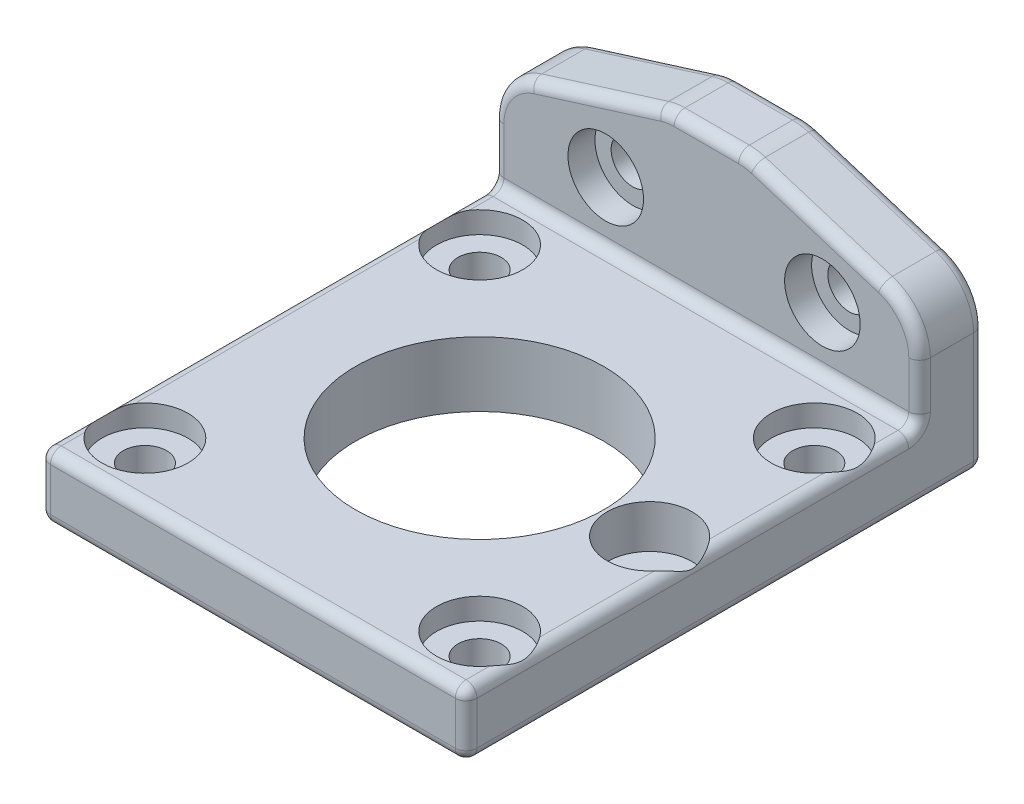
from build123d import *

# Parameters (mm, degrees)
SKETCH1_W           = 39.5
SKETCH1_H           = 42
BOSS_EXTRUDE1_DEPTH = 6
SKETCH3_R           = 3.9905
CUT_EXTRUDE1_DEPTH  = 2
SKETCH4_R           = 11.5
SKETCH4_R_2         = 2
CUT_EXTRUDE2_DEPTH  = 30.445925015
BOSS_EXTRUDE2_DEPTH = 6
SKETCH6_R           = 3.5
CUT_EXTRUDE3_DEPTH  = 2.5
SKETCH7_R           = 2
CUT_EXTRUDE4_DEPTH  = 51.537733428
FILLET1_R           = 5
SKETCH8_R           = 3.9365
CUT_EXTRUDE5_DEPTH  = 4
FILLET2_R           = 1


with BuildPart() as part:
    # Sketch1 → Boss-Extrude1 (new body)
    with BuildSketch(Plane(origin=(0, 0, 0), x_dir=(1, 0, 0), z_dir=(0, 1, 0))):
        Rectangle(SKETCH1_W, SKETCH1_H)
    extrude(amount=BOSS_EXTRUDE1_DEPTH)

    # Sketch3 → Cut-Extrude1 (cut)
    with BuildSketch(Plane(origin=(0, 6, 0), x_dir=(1, 0, 0), z_dir=(0, 1, 0))):
        with Locations(Location((-15.5, 15.5, 0), (0, 0, 270))):
            Circle(SKETCH3_R)
        with Locations(Location((15.5, 15.5, 0), (0, 0, 270))):
            Circle(SKETCH3_R)
        with Locations(Location((-15.5, -15.5, 0), (0, 0, 270))):
            Circle(SKETCH3_R)
        with Locations(Location((15.5, -15.5, 0), (0, 0, 270))):
            Circle(SKETCH3_R)
    extrude(amount=-CUT_EXTRUDE1_DEPTH, mode=Mode.SUBTRACT)

    # Sketch4 → Cut-Extrude2 (cut, through all)
    with BuildSketch(Plane(origin=(0, 6, 0), x_dir=(1, 0, 0), z_dir=(0, 1, 0))):
        with Locations(Location((0, 0, 0), (0, 0, 270))):
            Circle(SKETCH4_R)
        with Locations(Location((15.5, 15.5, 0), (0, 0, 270))):
            Circle(SKETCH4_R_2)
        with Locations(Location((-15.5, 15.5, 0), (0, 0, 270))):
            Circle(SKETCH4_R_2)
        with Locations(Location((-15.5, -15.5, 0), (0, 0, 270))):
            Circle(SKETCH4_R_2)
        with Locations(Location((15.5, -15.5, 0), (0, 0, 270))):
            Circle(SKETCH4_R_2)
    extrude(amount=-CUT_EXTRUDE2_DEPTH, mode=Mode.SUBTRACT)

    # Sketch5 → Boss-Extrude2 (add)
    with BuildSketch(Plane(origin=(0, 0, -21), x_dir=(-1, 0, 0), z_dir=(0, 0, -1))):
        Polygon((-19.75, 15), (-19.75, 0), (19.75, 0), (19.75, 15), (3.75, 20), (-3.75, 20), align=None)
    extrude(amount=BOSS_EXTRUDE2_DEPTH)

    # Sketch6 → Cut-Extrude3 (cut)
    with BuildSketch(Plane.XY.offset(-21)):
        with Locations((-9.32, 11.75)):
            Circle(SKETCH6_R)
        with Locations((10.75, 11.75)):
            Circle(SKETCH6_R)
    extrude(amount=-CUT_EXTRUDE3_DEPTH, mode=Mode.SUBTRACT)

    # Sketch7 → Cut-Extrude4 (cut, through all)
    with BuildSketch(Plane.XY.offset(-21)):
        with Locations((-9.32, 11.75)):
            Circle(SKETCH7_R)
        with Locations((10.75, 11.75)):
            Circle(SKETCH7_R)
    extrude(amount=-CUT_EXTRUDE4_DEPTH, mode=Mode.SUBTRACT)

    # Fillet1
    fillet1_edges = [part.edges().sort_by_distance(p)[0] for p in [
        (-19.75, 15, -24),
        (-3.75, 20, -24),
        (3.75, 20, -24),
        (19.75, 15, -24),
    ]]
    fillet(fillet1_edges, radius=FILLET1_R)

    # Sketch8 → Cut-Extrude5 (cut)
    with BuildSketch(Plane(origin=(0, 6, 0), x_dir=(1, 0, 0), z_dir=(0, 1, 0))):
        with Locations(Location((15.75, 0, 0), (0, 0, 270))):
            Circle(SKETCH8_R)
    extrude(amount=-CUT_EXTRUDE5_DEPTH, mode=Mode.SUBTRACT)

    # Fillet2
    # the kernel refuses this fillet: 1 mm, written as the material it adds along each edge
    with BuildSketch(Plane(origin=(-19.75, 6, -21), x_dir=(0, 1, 0), z_dir=(1, 0, 0))) as fillet2_piece_1:
        with BuildLine():
            CenterArc((FILLET2_R, FILLET2_R), FILLET2_R, 180, 90)
            Line((0, FILLET2_R), (0, 0))
            Line((0, 0), (FILLET2_R, 0))
        make_face()
    extrude(amount=39.5)
    # the kernel refuses this fillet: 1 mm, written as the material it takes off along each edge
    with BuildSketch(Plane(origin=(18.75, 1, 20), x_dir=(0, 0, 1), z_dir=(1, 0, 0))) as fillet2_2_piece_1_section:
        Polygon((0, 0), (FILLET2_R, 0), (FILLET2_R, FILLET2_R), (0, FILLET2_R), align=None)
    fillet2_2_piece_1 = extrude(amount=FILLET2_R, mode=Mode.PRIVATE)
    fillet2_2_piece_1 = fillet2_2_piece_1 - Plane(origin=(18.75, 1, 20), x_dir=(0, 0.7071067811865475, -0.7071067811865475), z_dir=(1, 0, 0)) * Sphere(FILLET2_R, mode=Mode.PRIVATE)
    add(fillet2_2_piece_1, mode=Mode.SUBTRACT)
    with BuildSketch(Plane(origin=(-18.75, 1, 20), x_dir=(0, 0, 1), z_dir=(-1, 0, 0))) as fillet2_2_piece_2_section:
        Polygon((0, 0), (FILLET2_R, 0), (FILLET2_R, -FILLET2_R), (0, -FILLET2_R), align=None)
    fillet2_2_piece_2 = extrude(amount=FILLET2_R, mode=Mode.PRIVATE)
    fillet2_2_piece_2 = fillet2_2_piece_2 - Plane(origin=(-18.75, 1, 20), x_dir=(0, 0.7071067811865475, -0.7071067811865475), z_dir=(-1, 0, 0)) * Sphere(FILLET2_R, mode=Mode.PRIVATE)
    add(fillet2_2_piece_2, mode=Mode.SUBTRACT)
    with BuildSketch(Plane(origin=(-18.75, 1, -26), x_dir=(0, 0, -1), z_dir=(-1, 0, 0))) as fillet2_2_piece_3_section:
        Polygon((0, 0), (FILLET2_R, 0), (FILLET2_R, FILLET2_R), (0, FILLET2_R), align=None)
    fillet2_2_piece_3 = extrude(amount=FILLET2_R, mode=Mode.PRIVATE)
    fillet2_2_piece_3 = fillet2_2_piece_3 - Plane(origin=(-18.75, 1, -26), x_dir=(0, 0.7071067811865475, 0.7071067811865475), z_dir=(-1, 0, 0)) * Sphere(FILLET2_R, mode=Mode.PRIVATE)
    add(fillet2_2_piece_3, mode=Mode.SUBTRACT)
    with BuildSketch(Plane(origin=(18.75, 1, -26), x_dir=(0, 0, -1), z_dir=(1, 0, 0))) as fillet2_2_piece_4_section:
        Polygon((0, 0), (FILLET2_R, 0), (FILLET2_R, -FILLET2_R), (0, -FILLET2_R), align=None)
    fillet2_2_piece_4 = extrude(amount=FILLET2_R, mode=Mode.PRIVATE)
    fillet2_2_piece_4 = fillet2_2_piece_4 - Plane(origin=(18.75, 1, -26), x_dir=(0, 0.7071067811865475, 0.7071067811865475), z_dir=(1, 0, 0)) * Sphere(FILLET2_R, mode=Mode.PRIVATE)
    add(fillet2_2_piece_4, mode=Mode.SUBTRACT)
    with BuildSketch(Plane(origin=(-2.986945386, 15, -27), x_dir=(-0.2982749931359463, 0.9544799780350299, 0), z_dir=(-0.9544799780350299, -0.2982749931359463, 0))) as fillet2_2_piece_5:
        with BuildLine():
            CenterArc((5 - FILLET2_R, -FILLET2_R), FILLET2_R, 0, 90)
            Line((5, -FILLET2_R), (5, 0))
            Line((5, 0), (5 - FILLET2_R, 0))
        make_face()
    revolve(axis=Axis((-2.986945386, 15, -27), (0, 0, -1)), revolution_arc=17.354024636, mode=Mode.SUBTRACT)
    with BuildSketch(Plane(origin=(2.986945386, 15, -27), x_dir=(0.29827499313594724, 0.9544799780350296, 0), z_dir=(0.9544799780350296, -0.29827499313594724, 0))) as fillet2_2_piece_6:
        with BuildLine():
            CenterArc((5 - FILLET2_R, FILLET2_R), FILLET2_R, 270, 90)
            Line((5, FILLET2_R), (5, 0))
            Line((5, 0), (5 - FILLET2_R, 0))
        make_face()
    revolve(axis=Axis((2.986945386, 15, -27), (0, 0, 1)), revolution_arc=17.354024636, mode=Mode.SUBTRACT)
    with BuildSketch(Plane(origin=(14.75, 11.324045433, -27), x_dir=(1, 0, 0), z_dir=(0, -1, 0))) as fillet2_2_piece_7:
        with BuildLine():
            CenterArc((5 - FILLET2_R, FILLET2_R), FILLET2_R, 270, 90)
            Line((5, FILLET2_R), (5, 0))
            Line((5, 0), (5 - FILLET2_R, 0))
        make_face()
    revolve(axis=Axis((14.75, 11.324045433, -27), (0, 0, 1)), revolution_arc=72.645975364, mode=Mode.SUBTRACT)
    with BuildSketch(Plane(origin=(22.25, 6, 21), x_dir=(0, 0, -1), z_dir=(-1, 0, 0))) as fillet2_2_piece_8:
        with BuildLine():
            CenterArc((FILLET2_R, FILLET2_R), FILLET2_R, 180, 90)
            Line((0, FILLET2_R), (0, 0))
            Line((0, 0), (FILLET2_R, 0))
        make_face()
    extrude(amount=44.5, mode=Mode.SUBTRACT)
    with BuildSketch(Plane(origin=(18.75, 0, 21), x_dir=(0, 1, 0), z_dir=(-1, 0, 0))) as fillet2_2_piece_9:
        with BuildLine():
            CenterArc((FILLET2_R, FILLET2_R), FILLET2_R, 180, 90)
            Line((0, FILLET2_R), (0, 0))
            Line((0, 0), (FILLET2_R, 0))
        make_face()
    extrude(amount=37.5, mode=Mode.SUBTRACT)
    with BuildSketch(Plane(origin=(-19.75, 0, -26), x_dir=(0, 1, 0), z_dir=(0, 0, 1)), Plane(origin=(19.75, 0, -26), x_dir=(-1, 0, 0), z_dir=(0, 0, 1))) as fillet2_2_piece_10:
        with BuildLine():
            CenterArc((FILLET2_R, -FILLET2_R), FILLET2_R, 90, 90)
            Line((0, -FILLET2_R), (0, 0))
            Line((0, 0), (FILLET2_R, 0))
        make_face()
    extrude(amount=46, mode=Mode.SUBTRACT)
    with BuildSketch(Plane(origin=(-19.75, 1, -27), x_dir=(0, 0, 1), z_dir=(0, 1, 0))) as fillet2_2_piece_11:
        with BuildLine():
            CenterArc((FILLET2_R, FILLET2_R), FILLET2_R, 180, 90)
            Line((0, FILLET2_R), (0, 0))
            Line((0, 0), (FILLET2_R, 0))
        make_face()
    extrude(amount=10.324045433, mode=Mode.SUBTRACT)
    with BuildSketch(Plane(origin=(18.75, 0, -27), x_dir=(0, 1, 0), z_dir=(-1, 0, 0))) as fillet2_2_piece_12:
        with BuildLine():
            CenterArc((FILLET2_R, -FILLET2_R), FILLET2_R, 90, 90)
            Line((0, -FILLET2_R), (0, 0))
            Line((0, 0), (FILLET2_R, 0))
        make_face()
    extrude(amount=37.5, mode=Mode.SUBTRACT)
    with BuildSketch(Plane(origin=(19.75, 1, 21), x_dir=(-1, 0, 0), z_dir=(0, 1, 0)), Plane(origin=(-19.75, 1, 21), x_dir=(0, 0, -1), z_dir=(0, 1, 0))) as fillet2_2_piece_13:
        with BuildLine():
            CenterArc((FILLET2_R, -FILLET2_R), FILLET2_R, 90, 90)
            Line((0, -FILLET2_R), (0, 0))
            Line((0, 0), (FILLET2_R, 0))
        make_face()
    extrude(amount=7.5, mode=Mode.SUBTRACT)
    with BuildSketch(Plane(origin=(19.75, 11.324045433, -27), x_dir=(-1, 0, 0), z_dir=(0, -1, 0))) as fillet2_2_piece_14:
        with BuildLine():
            CenterArc((FILLET2_R, -FILLET2_R), FILLET2_R, 90, 90)
            Line((0, -FILLET2_R), (0, 0))
            Line((0, 0), (FILLET2_R, 0))
        make_face()
    extrude(amount=10.324045433, mode=Mode.SUBTRACT)
    with BuildSketch(Plane(origin=(4.478320351, 19.77239989, -27), x_dir=(-0.29827499313594713, -0.9544799780350296, 0), z_dir=(0.9544799780350297, -0.29827499313594713, 0)), Plane(origin=(-16.241374966, 16.096445323, -27), x_dir=(0.2982749931359466, -0.9544799780350298, 0), z_dir=(0.9544799780350299, 0.29827499313594663, 0))) as fillet2_2_piece_15:
        with BuildLine():
            CenterArc((FILLET2_R, -FILLET2_R), FILLET2_R, 90, 90)
            Line((0, -FILLET2_R), (0, 0))
            Line((0, 0), (FILLET2_R, 0))
        make_face()
    extrude(amount=12.324045433, mode=Mode.SUBTRACT)
    with BuildSketch(Plane(origin=(-2.986945386, 20, -27), x_dir=(0, -1, 0), z_dir=(1, 0, 0))) as fillet2_2_piece_16:
        with BuildLine():
            CenterArc((FILLET2_R, -FILLET2_R), FILLET2_R, 90, 90)
            Line((0, -FILLET2_R), (0, 0))
            Line((0, 0), (FILLET2_R, 0))
        make_face()
    extrude(amount=5.973890772, mode=Mode.SUBTRACT)
    with BuildSketch(Plane(origin=(-14.75, 11.324045433, -27), x_dir=(-1, 0, 0), z_dir=(0, -1, 0))) as fillet2_2_piece_17:
        with BuildLine():
            CenterArc((5 - FILLET2_R, -FILLET2_R), FILLET2_R, 0, 90)
            Line((5 - FILLET2_R, 0), (5, 0))
            Line((5, 0), (5, -FILLET2_R))
        make_face()
    revolve(axis=Axis((-14.75, 11.324045433, -27), (0, 0, -1)), revolution_arc=72.645975364, mode=Mode.SUBTRACT)
    # the kernel refuses this fillet: 1 mm, written as the material it takes off along each edge
    with BuildSketch(Plane(origin=(18.75, 5, 20), x_dir=(1, 0, 0), z_dir=(0, 1, 0))) as fillet2_3_piece_1_section:
        Polygon((0, 0), (FILLET2_R, 0), (FILLET2_R, -FILLET2_R), (0, -FILLET2_R), align=None)
    fillet2_3_piece_1 = extrude(amount=FILLET2_R, mode=Mode.PRIVATE)
    fillet2_3_piece_1 = fillet2_3_piece_1 - Plane(origin=(18.75, 5, 20), x_dir=(-0.7071067811865476, 0, -0.7071067811865475), z_dir=(0, 1, 0)) * Sphere(FILLET2_R, mode=Mode.PRIVATE)
    add(fillet2_3_piece_1, mode=Mode.SUBTRACT)
    with BuildSketch(Plane(origin=(-18.75, 5, 20), x_dir=(0, 1, 0), z_dir=(-1, 0, 0))) as fillet2_3_piece_2_section:
        Polygon((0, 0), (FILLET2_R, 0), (FILLET2_R, -FILLET2_R), (0, -FILLET2_R), align=None)
    fillet2_3_piece_2 = extrude(amount=FILLET2_R, mode=Mode.PRIVATE)
    fillet2_3_piece_2 = fillet2_3_piece_2 - Plane(origin=(-18.75, 5, 20), x_dir=(0, -0.7071067811865475, -0.7071067811865475), z_dir=(-1, 0, 0)) * Sphere(FILLET2_R, mode=Mode.PRIVATE)
    add(fillet2_3_piece_2, mode=Mode.SUBTRACT)
    with BuildSketch(Plane(origin=(-19.75, 6, 20), x_dir=(0, -1, 0), z_dir=(0, 0, -1))) as fillet2_3_piece_3:
        with BuildLine():
            CenterArc((FILLET2_R, -FILLET2_R), FILLET2_R, 90, 90)
            Line((0, -FILLET2_R), (0, 0))
            Line((0, 0), (FILLET2_R, 0))
        make_face()
    extrude(amount=40, mode=Mode.SUBTRACT)
    with BuildSketch(Plane(origin=(19.75, 6, -20), x_dir=(-1, 0, 0), z_dir=(0, 0, 1))) as fillet2_3_piece_4:
        with BuildLine():
            CenterArc((FILLET2_R, FILLET2_R), FILLET2_R, 180, 90)
            Line((0, FILLET2_R), (0, 0))
            Line((0, 0), (FILLET2_R, 0))
        make_face()
    extrude(amount=40, mode=Mode.SUBTRACT)
    with BuildSketch(Plane(origin=(-19.75, 7, -21), x_dir=(0, 0, -1), z_dir=(0, 1, 0))) as fillet2_3_piece_5:
        with BuildLine():
            CenterArc((FILLET2_R, -FILLET2_R), FILLET2_R, 90, 90)
            Line((0, -FILLET2_R), (0, 0))
            Line((0, 0), (FILLET2_R, 0))
        make_face()
    extrude(amount=4.324045433, mode=Mode.SUBTRACT)
    with BuildSketch(Plane(origin=(19.75, 11.324045433, -21), x_dir=(-1, 0, 0), z_dir=(0, -1, 0))) as fillet2_3_piece_6:
        with BuildLine():
            CenterArc((FILLET2_R, FILLET2_R), FILLET2_R, 180, 90)
            Line((0, FILLET2_R), (0, 0))
            Line((0, 0), (FILLET2_R, 0))
        make_face()
    extrude(amount=4.324045433, mode=Mode.SUBTRACT)
    with BuildSketch(Plane(origin=(4.478320351, 19.77239989, -21), x_dir=(-0.29827499313594713, -0.9544799780350296, 0), z_dir=(0.9544799780350297, -0.29827499313594713, 0)), Plane(origin=(-16.241374966, 16.096445323, -21), x_dir=(0.2982749931359466, -0.9544799780350298, 0), z_dir=(0.9544799780350299, 0.29827499313594663, 0))) as fillet2_3_piece_7:
        with BuildLine():
            CenterArc((FILLET2_R, FILLET2_R), FILLET2_R, 180, 90)
            Line((0, FILLET2_R), (0, 0))
            Line((0, 0), (FILLET2_R, 0))
        make_face()
    extrude(amount=12.324045433, mode=Mode.SUBTRACT)
    with BuildSketch(Plane(origin=(-2.986945386, 20, -21), x_dir=(0, -1, 0), z_dir=(1, 0, 0))) as fillet2_3_piece_8:
        with BuildLine():
            CenterArc((FILLET2_R, FILLET2_R), FILLET2_R, 180, 90)
            Line((0, FILLET2_R), (0, 0))
            Line((0, 0), (FILLET2_R, 0))
        make_face()
    extrude(amount=5.973890772, mode=Mode.SUBTRACT)
    with BuildSketch(Plane(origin=(-14.75, 11.324045433, -21), x_dir=(-1, 0, 0), z_dir=(0, -1, 0))) as fillet2_3_piece_9:
        with BuildLine():
            CenterArc((5 - FILLET2_R, FILLET2_R), FILLET2_R, 270, 90)
            Line((5 - FILLET2_R, 0), (5, 0))
            Line((5, 0), (5, FILLET2_R))
        make_face()
    revolve(axis=Axis((-14.75, 11.324045433, -21), (0, 0, -1)), revolution_arc=72.645975364, mode=Mode.SUBTRACT)
    with BuildSketch(Plane(origin=(-2.986945386, 15, -21), x_dir=(-0.2982749931359463, 0.9544799780350299, 0), z_dir=(-0.9544799780350299, -0.2982749931359463, 0))) as fillet2_3_piece_10:
        with BuildLine():
            CenterArc((5 - FILLET2_R, FILLET2_R), FILLET2_R, 270, 90)
            Line((5, FILLET2_R), (5, 0))
            Line((5, 0), (5 - FILLET2_R, 0))
        make_face()
    revolve(axis=Axis((-2.986945386, 15, -21), (0, 0, -1)), revolution_arc=17.354024636, mode=Mode.SUBTRACT)
    with BuildSketch(Plane(origin=(2.986945386, 15, -21), x_dir=(0.29827499313594724, 0.9544799780350296, 0), z_dir=(0.9544799780350296, -0.29827499313594724, 0))) as fillet2_3_piece_11:
        with BuildLine():
            CenterArc((5 - FILLET2_R, -FILLET2_R), FILLET2_R, 0, 90)
            Line((5, -FILLET2_R), (5, 0))
            Line((5, 0), (5 - FILLET2_R, 0))
        make_face()
    revolve(axis=Axis((2.986945386, 15, -21), (0, 0, 1)), revolution_arc=17.354024636, mode=Mode.SUBTRACT)
    with BuildSketch(Plane(origin=(14.75, 11.324045433, -21), x_dir=(1, 0, 0), z_dir=(0, -1, 0))) as fillet2_3_piece_12:
        with BuildLine():
            CenterArc((5 - FILLET2_R, -FILLET2_R), FILLET2_R, 0, 90)
            Line((5, -FILLET2_R), (5, 0))
            Line((5, 0), (5 - FILLET2_R, 0))
        make_face()
    revolve(axis=Axis((14.75, 11.324045433, -21), (0, 0, 1)), revolution_arc=72.645975364, mode=Mode.SUBTRACT)
    with BuildSketch(Plane(origin=(19.75, 7, -20), x_dir=(0, 0, -1), z_dir=(0, 1, 0))) as fillet2_3_piece_13:
        with BuildLine():
            CenterArc((1 + FILLET2_R, FILLET2_R), FILLET2_R, 180, 90)
            Line((1 + FILLET2_R, 0), (1, 0))
            Line((1, 0), (1, FILLET2_R))
        make_face()
    revolve(axis=Axis((19.75, 7, -20), (-1, 0, 0)), revolution_arc=90, mode=Mode.SUBTRACT)
    with BuildSketch(Plane(origin=(-19.75, 7, -20), x_dir=(0, 0, -1), z_dir=(0, 1, 0))) as fillet2_3_piece_14:
        with BuildLine():
            CenterArc((1 + FILLET2_R, -FILLET2_R), FILLET2_R, 90, 90)
            Line((1, -FILLET2_R), (1, 0))
            Line((1, 0), (1 + FILLET2_R, 0))
        make_face()
    revolve(axis=Axis((-19.75, 7, -20), (-1, 0, 0)), revolution_arc=90, mode=Mode.SUBTRACT)


solid = part.part
